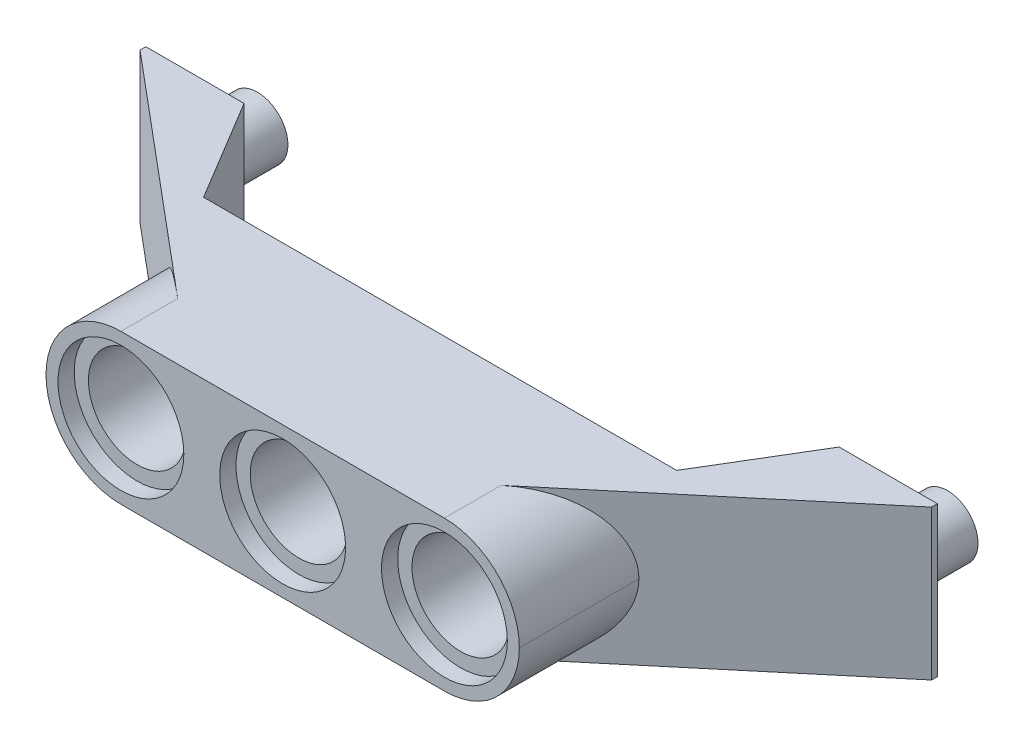
from build123d import *

# Parameters (mm, degrees)
SKETCH1_W           = 23.32
SKETCH1_H           = 7.38
BOSS_EXTRUDE1_DEPTH = 7.76
SKETCH4_R           = 2.4
CUT_EXTRUDE1_DEPTH  = 7.76
SKETCH5_R           = 3.1
CUT_EXTRUDE2_DEPTH  = 0.8
CUT_EXTRUDE3_START  = -0.8
SKETCH6_R           = 3.1
CUT_EXTRUDE3_DEPTH  = 0.8
SKETCH7_W           = 2
SKETCH7_H           = 7.38
BOSS_EXTRUDE2_DEPTH = 7.84
SKETCH8_W           = 2
SKETCH8_H           = 7.38
BOSS_EXTRUDE3_DEPTH = 7.84
SKETCH9_W           = 7.84
SKETCH9_H           = 7.38
BOSS_EXTRUDE4_DEPTH = 5
SKETCH10_R          = 1.5
BOSS_EXTRUDE5_DEPTH = 3
CHAMFER1_SIZE       = 8
CHAMFER1_SIZE_2     = 6.712797049
CHAMFER2_SIZE       = 6.712797049
CHAMFER2_SIZE_2     = 8
CHAMFER3_SIZE       = 3
CHAMFER3_SIZE2      = 4.992838447
CHAMFER4_SIZE       = 3
CHAMFER4_SIZE2      = 4.992838447
FILLET1_R           = 3.69


# Some blends are built 0.0001 mm under size
with BuildPart() as part:
    # Sketch1 → Boss-Extrude1 (new body)
    with BuildSketch(Plane.XY):
        with Locations((0.207481698, 1.946178624)):
            Rectangle(SKETCH1_W, SKETCH1_H)
    extrude(amount=BOSS_EXTRUDE1_DEPTH)

    # Sketch4 → Cut-Extrude1 (cut)
    with BuildSketch(Plane.XY.offset(7.76)):
        with Locations((0.207481698, 1.946178624)):
            Circle(SKETCH4_R)
        with Locations((8.177481698, 1.946178624)):
            Circle(SKETCH4_R)
        with Locations((-7.762518302, 1.946178624)):
            Circle(SKETCH4_R)
    extrude(amount=-CUT_EXTRUDE1_DEPTH, mode=Mode.SUBTRACT)

    # Sketch5 → Cut-Extrude2 (cut)
    with BuildSketch(Plane.XY.offset(7.76)):
        with Locations((-7.762518302, 1.946178624)):
            Circle(SKETCH5_R)
        with Locations((0.207481698, 1.946178624)):
            Circle(SKETCH5_R)
        with Locations((8.177481698, 1.946178624)):
            Circle(SKETCH5_R)
    extrude(amount=-CUT_EXTRUDE2_DEPTH, mode=Mode.SUBTRACT)

    # Sketch6 → Cut-Extrude3 (cut)
    with BuildSketch(Plane(origin=(0, 0, 0), x_dir=(-1, 0, 0), z_dir=(0, 0, -1)).offset(CUT_EXTRUDE3_START)):
        with Locations(Location((-8.177481698, 1.946178624, 0), (0, 0, 180))):
            Circle(SKETCH6_R)
        with Locations(Location((-0.207481698, 1.946178624, 0), (0, 0, 180))):
            Circle(SKETCH6_R)
        with Locations(Location((7.762518302, 1.946178624, 0), (0, 0, 180))):
            Circle(SKETCH6_R)
    extrude(amount=CUT_EXTRUDE3_DEPTH, mode=Mode.SUBTRACT)

    # Sketch7 → Boss-Extrude2 (add)
    with BuildSketch(Plane(origin=(11.867481698, 0, 0), x_dir=(0, 0, -1), z_dir=(1, 0, 0))):
        with Locations((-1, 1.946178624)):
            Rectangle(SKETCH7_W, SKETCH7_H)
    extrude(amount=BOSS_EXTRUDE2_DEPTH)

    # Sketch8 → Boss-Extrude3 (add)
    with BuildSketch(Plane.ZY.offset(11.452518302)):
        with Locations((1, 1.946178624)):
            Rectangle(SKETCH8_W, SKETCH8_H)
    extrude(amount=BOSS_EXTRUDE3_DEPTH)

    # Sketch9 → Boss-Extrude4 (add)
    with BuildSketch(Plane(origin=(0, 0, 0), x_dir=(-1, 0, 0), z_dir=(0, 0, -1))):
        with Locations((-15.787481698, 1.946178624)):
            Rectangle(SKETCH9_W, SKETCH9_H)
        with Locations((15.372518302, 1.946178624)):
            Rectangle(SKETCH9_W, SKETCH9_H)
    extrude(amount=BOSS_EXTRUDE4_DEPTH)

    # Sketch10 → Boss-Extrude5 (add)
    with BuildSketch(Plane(origin=(0, 0, -5), x_dir=(-1, 0, 0), z_dir=(0, 0, -1))):
        with Locations((16.792518302, 1.946178624)):
            Circle(SKETCH10_R)
        with Locations(Location((-17.207481698, 1.946178624, 0), (0, 0, 180))):
            Circle(SKETCH10_R)
    extrude(amount=BOSS_EXTRUDE5_DEPTH)

    # Chamfer1
    # the kernel refuses this chamfer: 8, 6.712797049 mm, written as the material it takes off along each edge
    with BuildSketch(Plane(origin=(19.707481698, 26.25542745, 2), x_dir=(-0.9996889667359941, 0, 0.024939322090234348), z_dir=(0, -1, 0))) as chamfer1_piece_1_section:
        Polygon((CHAMFER1_SIZE * 0.999688966736, CHAMFER1_SIZE * 0.0249393220902), (-CHAMFER1_SIZE_2 * 0.0249393220918, CHAMFER1_SIZE_2 * 0.999688966798), (0, 0), align=None)
    chamfer1_piece_1 = extrude(amount=48.618497654, mode=Mode.PRIVATE)
    chamfer1_piece_1 = split(chamfer1_piece_1, bisect_by=Plane(origin=(11.867481698, 1.946178624, -0.208519476), z_dir=(1, 0, 0)), keep=Keep.TOP, mode=Mode.PRIVATE)
    add(chamfer1_piece_1, mode=Mode.SUBTRACT)

    # Chamfer2
    # the kernel refuses this chamfer: 8, 6.712797049 mm, written as the material it takes off along each edge
    with BuildSketch(Plane(origin=(-19.292518302, -22.363070203, 2), x_dir=(-0.035409536913662526, 0, -0.9993728857116146), z_dir=(0, 1, 0))) as chamfer2_piece_1_section:
        Polygon((CHAMFER2_SIZE * 0.999372885774, -CHAMFER2_SIZE * 0.0354095369159), (-CHAMFER2_SIZE_2 * 0.0354095369137, -CHAMFER2_SIZE_2 * 0.999372885712), (0, 0), align=None)
    chamfer2_piece_1 = extrude(amount=48.618497654, mode=Mode.PRIVATE)
    chamfer2_piece_1 = split(chamfer2_piece_1, bisect_by=Plane(origin=(-11.452518302, 1.946178624, -0.208519476), z_dir=(-1, 0, 0)), keep=Keep.TOP, mode=Mode.PRIVATE)
    add(chamfer2_piece_1, mode=Mode.SUBTRACT)

    # Chamfer3
    chamfer3_edges = [part.edges().sort_by_distance(p)[0] for p in [
        (11.867481698, 1.946178624, -5),
    ]]
    chamfer3_side = [part.faces().sort_by_distance(p)[0] for p in [
        (15.589858806, 1.946178624, -5),
    ]]
    chamfer(chamfer3_edges, length=CHAMFER3_SIZE, length2=CHAMFER3_SIZE2, reference=chamfer3_side[0])

    # Chamfer4
    chamfer4_edges = [part.edges().sort_by_distance(p)[0] for p in [
        (-11.452518302, 1.946178624, -5),
    ]]
    chamfer4_side = [part.faces().sort_by_distance(p)[0] for p in [
        (-15.17489541, 1.946178624, -5),
    ]]
    chamfer(chamfer4_edges, length=CHAMFER4_SIZE, length2=CHAMFER4_SIZE2, reference=chamfer4_side[0])

    # Fillet1
    fillet1_edges = [part.edges().sort_by_distance(p)[0] for p in [
        (11.867481698, -1.743821376, 4.81287203),
        (11.867481698, 5.636178624, 4.81287203),
        (-11.452518302, 5.636178624, 4.81287203),
        (-11.452518302, -1.743821376, 4.81287203),
    ]]
    fillet(fillet1_edges, radius=FILLET1_R - 0.0001)  # a hair under: the kernel refuses the full size


solid = part.part
